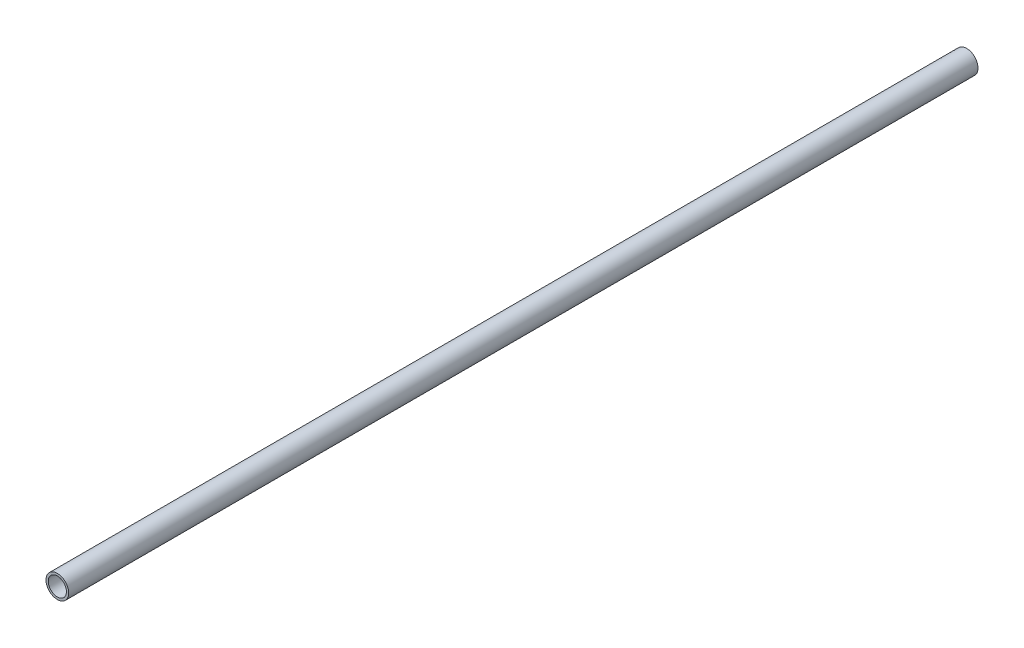
from build123d import *

# Parameters (mm, degrees)
SKETCH1_R   = 5
SKETCH1_R_2 = 4
BODY_DEPTH  = 400


with BuildPart() as part:
    # Sketch1 → body (new body)
    with BuildSketch(Plane.XY):
        Circle(SKETCH1_R)
        Circle(SKETCH1_R_2, mode=Mode.SUBTRACT)
    extrude(amount=BODY_DEPTH)


solid = part.part
